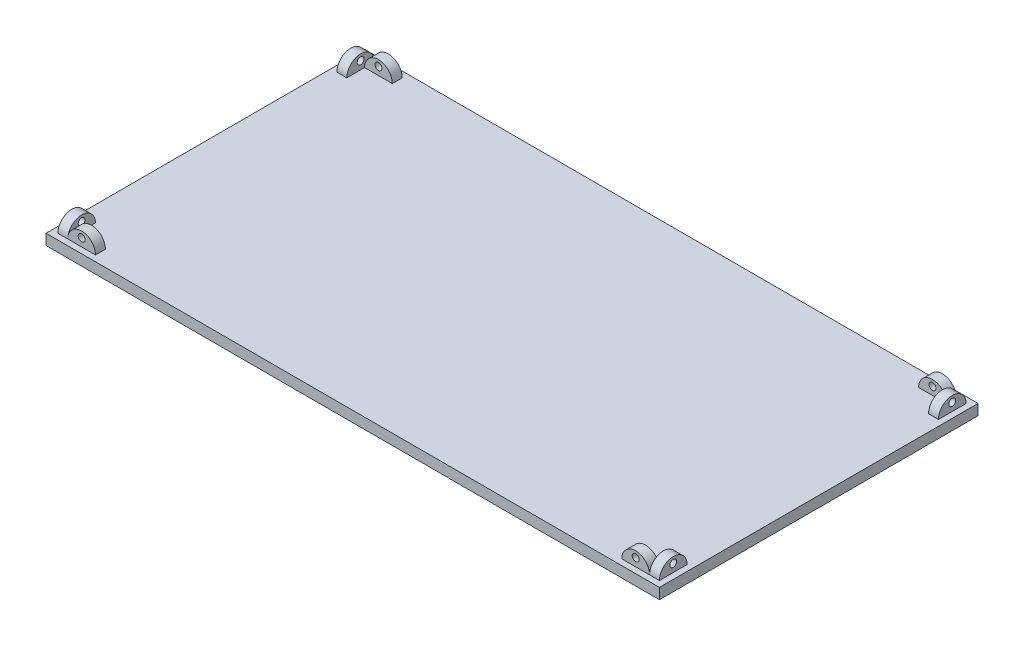
from build123d import *

# Parameters (mm, degrees)
SKETCH1_W                   = 310
SKETCH1_H                   = 161
BASE_DEPTH                  = 5.4
SKETCH3_R                   = 1.75
LONG_SIDE_CONNECTORS_DEPTH  = 5
SKETCH4_R                   = 1.75
SHORT_SIDE_CONNECTORS_DEPTH = 5
MIRROR3_COPY_1_SKETCH_R     = 1.75
MIRROR3_COPY_1_DEPTH        = 5
MIRROR3_COPY_2_SKETCH_R     = 1.75
MIRROR3_COPY_2_DEPTH        = 5


with BuildPart() as part:
    # Sketch1 → Base (new body)
    with BuildSketch(Plane(origin=(0, 0, 0), x_dir=(1, 0, 0), z_dir=(0, 1, 0))):
        with Locations((0.935618329, -1.385718523)):
            Rectangle(SKETCH1_W, SKETCH1_H)
    extrude(amount=-BASE_DEPTH)

    # Sketch3 → Long_Side_connectors (add)
    # profile 1 of 2: a face of its own
    with BuildSketch(Plane(origin=(-151.064381671, 0, 0), x_dir=(0, 0, -1), z_dir=(1, 0, 0))):
        with BuildLine():
            Line((62.114281477, 0), (76.114281477, 0))
            ThreePointArc((76.114281477, 0), (69.114281477, 7), (62.114281477, 0))
        make_face()
        with Locations((69.114281477, 4)):
            Circle(SKETCH3_R, mode=Mode.SUBTRACT)
    # profile 2 of 2: a face of its own
    with BuildSketch(Plane(origin=(-151.064381671, 0, 0), x_dir=(0, 0, -1), z_dir=(1, 0, 0))):
        with BuildLine():
            Line((-78.885718523, 0), (-64.885718523, 0))
            ThreePointArc((-64.885718523, 0), (-71.885718523, 7), (-78.885718523, 0))
        make_face()
        with Locations((-71.885718523, 4)):
            Circle(SKETCH3_R, mode=Mode.SUBTRACT)
    long_side_connectors = extrude(amount=LONG_SIDE_CONNECTORS_DEPTH)

    # Sketch4 → Short_side_connectors (add)
    with BuildSketch(Plane.XY.offset(78.885718523)):
        with BuildLine():
            Line((-146.064381671, 0), (-132.064381671, 0))
            ThreePointArc((-132.064381671, 0), (-139.064381671, 7), (-146.064381671, 0))
        make_face()
        with Locations((-139.064381671, 4)):
            Circle(SKETCH4_R, mode=Mode.SUBTRACT)
    short_side_connectors = extrude(amount=-SHORT_SIDE_CONNECTORS_DEPTH)

    # Mirror1: Short_side_connectors across plane
    add(short_side_connectors.mirror(Plane.XY.offset(1.385718523)))

    # Mirror3: Long_Side_connectors across plane
    add(long_side_connectors.mirror(Plane(origin=(0.935618329, 0, 0), x_dir=(0, 0, 1), z_dir=(1, 0, 0))))

    # Mirror3 copy 1 sketch → Mirror3 copy 1 (add)
    with BuildSketch(Plane(origin=(1.871236658, 0, -76.114281477), x_dir=(-1, 0, 0), z_dir=(0, 0, -1))):
        with BuildLine():
            Line((-146.064381671, 0), (-132.064381671, 0))
            ThreePointArc((-132.064381671, 0), (-139.064381671, 7), (-146.064381671, 0))
        make_face()
        with Locations((-139.064381671, 4)):
            Circle(MIRROR3_COPY_1_SKETCH_R, mode=Mode.SUBTRACT)
    extrude(amount=-MIRROR3_COPY_1_DEPTH)

    # Mirror3 copy 2 sketch → Mirror3 copy 2 (add)
    with BuildSketch(Plane(origin=(1.871236658, 0, 78.885718523), x_dir=(-1, 0, 0), z_dir=(0, 0, 1))):
        with BuildLine():
            Line((-146.064381671, 0), (-132.064381671, 0))
            ThreePointArc((-132.064381671, 0), (-139.064381671, -7), (-146.064381671, 0))
        make_face()
        with Locations((-139.064381671, -4)):
            Circle(MIRROR3_COPY_2_SKETCH_R, mode=Mode.SUBTRACT)
    extrude(amount=-MIRROR3_COPY_2_DEPTH)


solid = part.part
